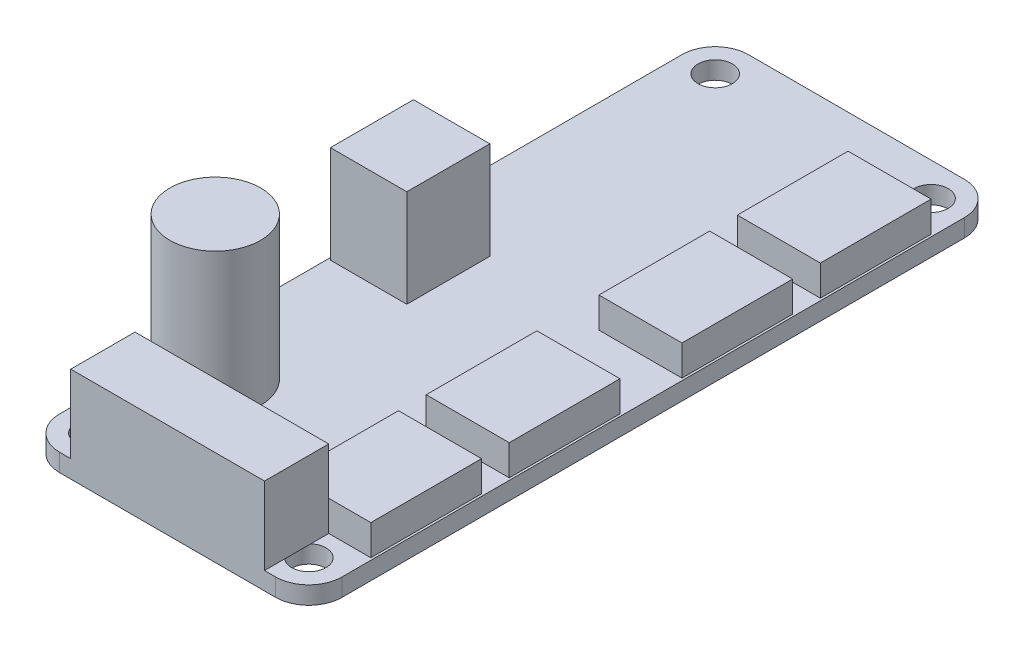
from build123d import *

# Parameters (mm, degrees)
SKETCH1_R           = 1.55
BOSS_EXTRUDE1_DEPTH = 1.6
SKETCH2_W           = 6.9
SKETCH2_H           = 7.5
BOSS_EXTRUDE2_DEPTH = 8.8
SKETCH3_R           = 4.1
BOSS_EXTRUDE3_DEPTH = 12.9
SKETCH4_W           = 7.5
SKETCH4_H           = 10
BOSS_EXTRUDE4_DEPTH = 2.75
SKETCH6_W           = 17.5
SKETCH6_H           = 5.8
BOSS_EXTRUDE5_DEPTH = 7


with BuildPart() as part:
    # Sketch1 → Boss-Extrude1 (new body)
    with BuildSketch(Plane(origin=(0, 0, 0), x_dir=(1, 0, 0), z_dir=(0, 1, 0))):
        with BuildLine():
            Line((3, 0), (22.5, 0))
            ThreePointArc((22.5, 0), (24.621320344, 0.878679656), (25.5, 3))
            Line((25.5, 3), (25.5, 59.2))
            ThreePointArc((25.5, 59.2), (24.621320344, 61.321320344), (22.5, 62.2))
            Line((22.5, 62.2), (3, 62.2))
            ThreePointArc((3, 62.2), (0.878679656, 61.321320344), (0, 59.2))
            Line((0, 59.2), (0, 3))
            ThreePointArc((0, 3), (0.878679656, 0.878679656), (3, 0))
        make_face()
        with Locations((3, 59.2)):
            Circle(SKETCH1_R, mode=Mode.SUBTRACT)
        with Locations((22.5, 59.2)):
            Circle(SKETCH1_R, mode=Mode.SUBTRACT)
        with Locations((22.5, 3)):
            Circle(SKETCH1_R, mode=Mode.SUBTRACT)
        with Locations((3, 3)):
            Circle(SKETCH1_R, mode=Mode.SUBTRACT)
    extrude(amount=BOSS_EXTRUDE1_DEPTH)

    # Sketch2 → Boss-Extrude2 (add)
    with BuildSketch(Plane(origin=(0, 1.6, 0), x_dir=(1, 0, 0), z_dir=(0, 1, 0))):
        with Locations((3.65, 31)):
            Rectangle(SKETCH2_W, SKETCH2_H)
    extrude(amount=BOSS_EXTRUDE2_DEPTH)

    # Sketch3 → Boss-Extrude3 (add)
    with BuildSketch(Plane(origin=(0, 1.6, 0), x_dir=(1, 0, 0), z_dir=(0, 1, 0))):
        with Locations((4.3, 12.75)):
            Circle(SKETCH3_R)
    extrude(amount=BOSS_EXTRUDE3_DEPTH)

    # Sketch4 → Boss-Extrude4 (add)
    with BuildSketch(Plane(origin=(0, 1.6, 0), x_dir=(1, 0, 0), z_dir=(0, 1, 0))):
        with Locations((21.55, 10.8)):
            Rectangle(SKETCH4_W, SKETCH4_H)
        with Locations((21.55, 23.3)):
            Rectangle(SKETCH4_W, SKETCH4_H)
        with Locations((21.55, 38.9)):
            Rectangle(SKETCH4_W, SKETCH4_H)
        with Locations((21.55, 51.4)):
            Rectangle(SKETCH4_W, SKETCH4_H)
    extrude(amount=BOSS_EXTRUDE4_DEPTH)

    # Sketch6 → Boss-Extrude5 (add)
    with BuildSketch(Plane(origin=(0, 1.6, 0), x_dir=(1, 0, 0), z_dir=(0, 1, 0))):
        with Locations((12.75, 2.9)):
            Rectangle(SKETCH6_W, SKETCH6_H)
    extrude(amount=BOSS_EXTRUDE5_DEPTH)


solid = part.part
